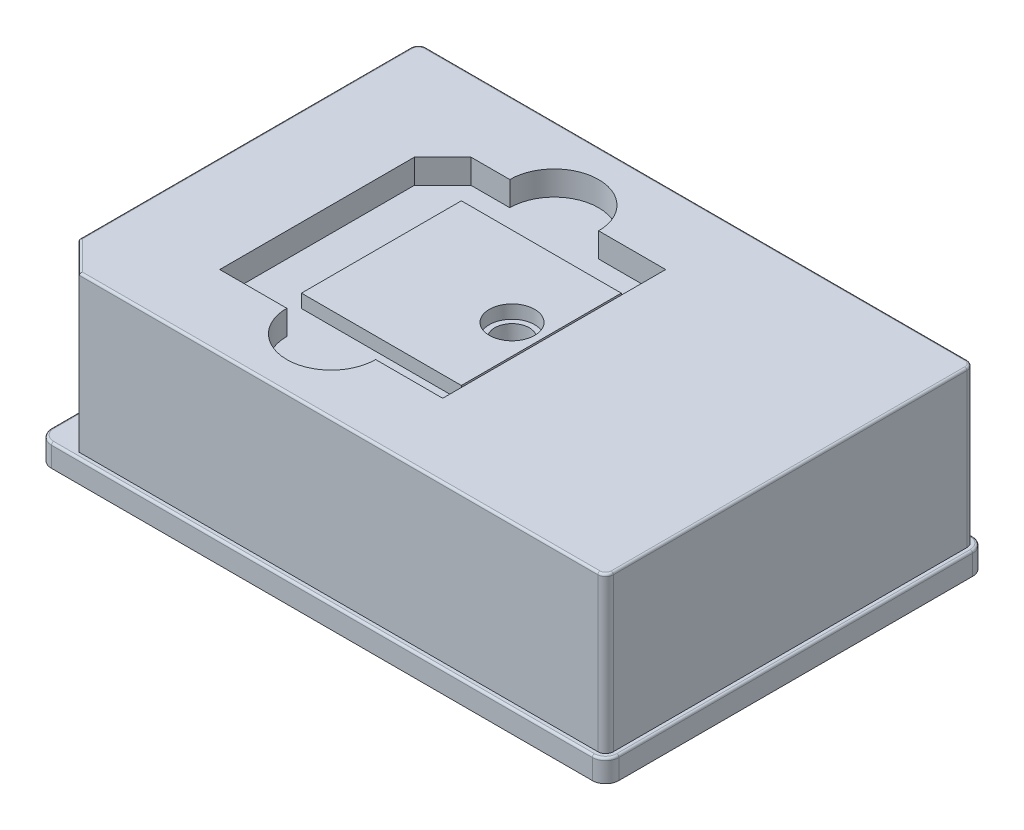
from build123d import *

# Parameters (mm, degrees)
SKETCH1_W           = 127.75
SKETCH1_H           = 85.6
BOSS_EXTRUDE1_DEPTH = 40
FILLET1_R           = 3
CUT_EXTRUDE2_DEPTH  = 35
FILLET5_R           = 0.5
FILLET6_R           = 0.5
CUT_EXTRUDE3_DEPTH  = 5.5
SKETCH8_W           = 36
SKETCH8_H           = 36
BOSS_EXTRUDE2_DEPTH = 3
SKETCH9_R           = 5.1
CUT_EXTRUDE5_DEPTH  = 3
SKETCH10_R          = 3.9
SKETCH11_R          = 3.7
SHELL1_DEPTH        = 35.5
SHELL1_START        = 35.5
SHELL1_2_DEPTH      = 2.5
SHELL1_3_DEPTH      = 3
SHELL1_START_2      = 3
SHELL1_4_DEPTH      = 0.5
SHELL1_START_3      = -55.046572875
SHELL1_6_DEPTH      = 115.671572875
BOSS_EXTRUDE3_REACH = 81.974
SKETCH13_W          = 2
SKETCH13_H          = 79.1
SKETCH13_H_2        = 33.940393737


with BuildPart() as part:
    # Sketch1 → Boss-Extrude1 (new body)
    with BuildSketch(Plane(origin=(0, 0, 0), x_dir=(1, 0, 0), z_dir=(0, 1, 0))):
        Rectangle(SKETCH1_W, SKETCH1_H)
    extrude(amount=BOSS_EXTRUDE1_DEPTH)

    # Fillet1
    fillet1_edges = [part.edges().sort_by_distance(p)[0] for p in [
        (-63.875, 20, -42.8),
        (63.875, 20, -42.8),
        (63.875, 20, 42.8),
        (-63.875, 20, 42.8),
    ]]
    fillet(fillet1_edges, radius=FILLET1_R)

    # Sketch3 → Cut-Extrude2 (cut)
    with BuildSketch(Plane(origin=(0, 40, 0), x_dir=(1, 0, 0), z_dir=(0, 1, 0))):
        with BuildLine():
            Line((-63.875, 39.8), (-63.875, -39.8))
            ThreePointArc((-63.875, -39.8), (-62.996320344, -41.921320344), (-60.875, -42.8))
            Line((-60.875, -42.8), (60.875, -42.8))
            ThreePointArc((60.875, -42.8), (62.996320344, -41.921320344), (63.875, -39.8))
            Line((63.875, -39.8), (63.875, 39.8))
            ThreePointArc((63.875, 39.8), (62.996320344, 41.921320344), (60.875, 42.8))
            Line((60.875, 42.8), (-60.875, 42.8))
            ThreePointArc((-60.875, 42.8), (-62.996320344, 41.921320344), (-63.875, 39.8))
        make_face()
        with BuildLine():
            Line((-62.625, 39.8), (-62.625, -34.8))
            Line((-62.625, -34.8), (-55.875, -41.55))
            Line((-55.875, -41.55), (60.875, -41.55))
            ThreePointArc((60.875, -41.55), (62.112436867, -41.037436867), (62.625, -39.8))
            Line((62.625, -39.8), (62.625, 39.8))
            ThreePointArc((62.625, 39.8), (62.112436867, 41.037436867), (60.875, 41.55))
            Line((60.875, 41.55), (-60.875, 41.55))
            ThreePointArc((-60.875, 41.55), (-62.112436867, 41.037436867), (-62.625, 39.8))
        make_face(mode=Mode.SUBTRACT)
    extrude(amount=-CUT_EXTRUDE2_DEPTH, mode=Mode.SUBTRACT)

    # Fillet5
    fillet5_edges = [part.edges().sort_by_distance(p)[0] for p in [
        (-62.996320344, 5, -41.921320344),
        (0, 5, -42.8),
        (62.996320344, 5, -41.921320344),
        (63.875, 5, 0),
        (62.996320344, 5, 41.921320344),
        (0, 5, 42.8),
        (-62.996320344, 5, 41.921320344),
        (-63.875, 5, 0),
    ]]
    fillet(fillet5_edges, radius=FILLET5_R)

    # Fillet6
    fillet6_edges = [part.edges().sort_by_distance(p)[0] for p in [
        (-62.112436867, 40, -41.037436867),
        (0, 40, -41.55),
        (62.112436867, 40, -41.037436867),
        (62.625, 40, 0),
        (62.112436867, 40, 41.037436867),
        (2.5, 40, 41.55),
        (-59.25, 40, 38.175),
        (-62.625, 40, -2.5),
    ]]
    fillet(fillet6_edges, radius=FILLET6_R)

    # Sketch5 → Cut-Extrude3 (cut)
    with BuildSketch(Plane(origin=(0, 40, 0), x_dir=(1, 0, 0), z_dir=(0, 1, 0))):
        with BuildLine():
            Line((-40.7, -25.1), (-25.6, -25.1))
            ThreePointArc((-25.6, -25.1), (-15.6, -35.1), (-5.6, -25.1))
            Line((-5.6, -25.1), (9.5, -25.1))
            Line((9.5, -25.1), (9.5, 25.1))
            Line((9.5, 25.1), (-5.6, 25.1))
            ThreePointArc((-5.6, 25.1), (-15.6, 35.1), (-25.6, 25.1))
            Line((-25.6, 25.1), (-34.336038969, 25.1))
            Line((-34.336038969, 25.1), (-40.7, 18.736038969))
            Line((-40.7, 18.736038969), (-40.7, -25.1))
        make_face()
    extrude(amount=-CUT_EXTRUDE3_DEPTH, mode=Mode.SUBTRACT)

    # Sketch8 → Boss-Extrude2 (add)
    with BuildSketch(Plane(origin=(0, 34.5, 0), x_dir=(1, 0, 0), z_dir=(0, 1, 0))):
        with Locations((-11.4, 0)):
            Rectangle(SKETCH8_W, SKETCH8_H)
    extrude(amount=BOSS_EXTRUDE2_DEPTH)

    # Sketch9 → Cut-Extrude5 (cut)
    with BuildSketch(Plane(origin=(0, 37.5, 0), x_dir=(1, 0, 0), z_dir=(0, 1, 0))):
        with Locations(Location((0, 0, 0), (0, 0, 270))):
            Circle(SKETCH9_R)
    extrude(amount=-CUT_EXTRUDE5_DEPTH, mode=Mode.SUBTRACT)

    # Sketch10 → Cut-Loft1 section 0
    with BuildSketch(Plane(origin=(0, 34.5, 0), x_dir=(1, 0, 0), z_dir=(0, 1, 0))):
        Circle(SKETCH10_R)
    # Sketch11 → Cut-Loft1 section 1
    with BuildSketch(Plane(origin=(0, 18.5, 0), x_dir=(1, 0, 0), z_dir=(0, 1, 0))):
        Circle(SKETCH11_R)
    loft(mode=Mode.SUBTRACT)

    # Sketch12 → Cut-Revolve1 (revolve, cut)
    with BuildSketch(Plane.XY, mode=Mode.PRIVATE) as cut_revolve1_sk:
        Polygon((0, 18.5), (3.700000041, 18.5), (1.65, 5.5), (0, 5.5), align=None)
    revolve(cut_revolve1_sk.sketch.rotate(Axis((0, 0, 0), (0, 1, 0)), 270), axis=Axis((0, 0, 0), (0, 1, 0)), mode=Mode.SUBTRACT)

    # Shell1: read off the stored shape, not the designer's step
    # Shell1 outline → Shell1 (cut)
    # profile 1 of 2: a face of its own
    with BuildSketch(Plane(origin=(0, 0, 0), x_dir=(1, 0, 0), z_dir=(0, 1, 0))):
        Polygon((60.625, -39.55), (60.625, 39.55), (-60.625, 39.55), (-60.625, -33.971572875), (-55.046572875, -39.55), align=None)
        with BuildLine():
            Line((-3.767840434, 27.1), (11.5, 27.1))
            Line((11.5, 27.1), (11.5, -27.1))
            Line((11.5, -27.1), (-3.767840434, -27.1))
            ThreePointArc((-3.767840434, -27.1), (-15.6, -37.1), (-27.432159566, -27.1))
            Line((-27.432159566, -27.1), (-42.7, -27.1))
            Line((-42.7, -27.1), (-42.7, 19.564466094))
            Line((-42.7, 19.564466094), (-35.164466094, 27.1))
            Line((-35.164466094, 27.1), (-27.432159566, 27.1))
            ThreePointArc((-27.432159566, 27.1), (-15.6, 37.1), (-3.767840434, 27.1))
        make_face(mode=Mode.SUBTRACT)
    # profile 2 of 2: a face of its own
    with BuildSketch(Plane(origin=(0, 0, 0), x_dir=(1, 0, 0), z_dir=(0, 1, 0))):
        with BuildLine():
            Line((4.6, -16), (4.6, -5.408326913))
            ThreePointArc((4.6, -5.408326913), (-7.1, 0), (4.6, 5.408326913))
            Line((4.6, 5.408326913), (4.6, 16))
            Line((4.6, 16), (-27.4, 16))
            Line((-27.4, 16), (-27.4, -16))
            Line((-27.4, -16), (4.6, -16))
        make_face()
    extrude(amount=SHELL1_DEPTH, mode=Mode.SUBTRACT)

    # Shell1 2 outline → Shell1 2 (cut)
    with BuildSketch(Plane(origin=(0, 0, 0), x_dir=(1, 0, 0), z_dir=(0, 1, 0)).offset(SHELL1_START)):
        Polygon((60.625, -39.55), (60.625, 39.55), (-60.625, 39.55), (-60.625, -33.971572875), (-55.046572875, -39.55), align=None)
        with BuildLine():
            Line((-3.767840434, 27.1), (11.5, 27.1))
            Line((11.5, 27.1), (11.5, -27.1))
            Line((11.5, -27.1), (-3.767840434, -27.1))
            ThreePointArc((-3.767840434, -27.1), (-15.6, -37.1), (-27.432159566, -27.1))
            Line((-27.432159566, -27.1), (-42.7, -27.1))
            Line((-42.7, -27.1), (-42.7, 19.564466094))
            Line((-42.7, 19.564466094), (-35.164466094, 27.1))
            Line((-35.164466094, 27.1), (-27.432159566, 27.1))
            ThreePointArc((-27.432159566, 27.1), (-15.6, 37.1), (-3.767840434, 27.1))
        make_face(mode=Mode.SUBTRACT)
    extrude(amount=SHELL1_2_DEPTH, mode=Mode.SUBTRACT)

    # Shell1 3 outline → Shell1 3 (cut)
    # profile 1 of 2: a face of its own
    with BuildSketch(Plane(origin=(0, 0, 0), x_dir=(1, 0, 0), z_dir=(0, 1, 0))):
        with BuildLine():
            Line((-61.875, 39.8), (-61.875, -39.8))
            ThreePointArc((-61.875, -39.8), (-61.582106781, -40.507106781), (-60.875, -40.8))
            Line((-60.875, -40.8), (60.875, -40.8))
            ThreePointArc((60.875, -40.8), (61.582106781, -40.507106781), (61.875, -39.8))
            Line((61.875, -39.8), (61.875, 39.8))
            ThreePointArc((61.875, 39.8), (61.582106781, 40.507106781), (60.875, 40.8))
            Line((60.875, 40.8), (-60.875, 40.8))
            ThreePointArc((-60.875, 40.8), (-61.582106781, 40.507106781), (-61.875, 39.8))
        make_face()
        Polygon((-60.625, 39.55), (60.625, 39.55), (60.625, -39.55), (-55.046572875, -39.55), (-60.625, -33.971572875), align=None, mode=Mode.SUBTRACT)
    # profile 2 of 2: a face of its own
    with BuildSketch(Plane(origin=(0, 0, 0), x_dir=(1, 0, 0), z_dir=(0, 1, 0))):
        with BuildLine():
            Line((11.5, -27.1), (11.5, 27.1))
            Line((11.5, 27.1), (-3.767840434, 27.1))
            ThreePointArc((-3.767840434, 27.1), (-15.6, 37.1), (-27.432159566, 27.1))
            Line((-27.432159566, 27.1), (-35.164466094, 27.1))
            Line((-35.164466094, 27.1), (-42.7, 19.564466094))
            Line((-42.7, 19.564466094), (-42.7, -27.1))
            Line((-42.7, -27.1), (-27.432159566, -27.1))
            ThreePointArc((-27.432159566, -27.1), (-15.6, -37.1), (-3.767840434, -27.1))
            Line((-3.767840434, -27.1), (11.5, -27.1))
        make_face()
        with BuildLine():
            ThreePointArc((4.6, 5.408326913), (-7.1, 0), (4.6, -5.408326913))
            Line((4.6, -5.408326913), (4.6, -16))
            Line((4.6, -16), (-27.4, -16))
            Line((-27.4, -16), (-27.4, 16))
            Line((-27.4, 16), (4.6, 16))
            Line((4.6, 16), (4.6, 5.408326913))
        make_face(mode=Mode.SUBTRACT)
    extrude(amount=SHELL1_3_DEPTH, mode=Mode.SUBTRACT)

    # Shell1 4 outline → Shell1 4 (cut)
    with BuildSketch(Plane(origin=(0, 0, 0), x_dir=(1, 0, 0), z_dir=(0, 1, 0)).offset(SHELL1_START_2)):
        with BuildLine():
            Line((11.5, -27.1), (11.5, 27.1))
            Line((11.5, 27.1), (-3.767840434, 27.1))
            ThreePointArc((-3.767840434, 27.1), (-15.6, 37.1), (-27.432159566, 27.1))
            Line((-27.432159566, 27.1), (-35.164466094, 27.1))
            Line((-35.164466094, 27.1), (-42.7, 19.564466094))
            Line((-42.7, 19.564466094), (-42.7, -27.1))
            Line((-42.7, -27.1), (-27.432159566, -27.1))
            ThreePointArc((-27.432159566, -27.1), (-15.6, -37.1), (-3.767840434, -27.1))
            Line((-3.767840434, -27.1), (11.5, -27.1))
        make_face()
        with BuildLine():
            ThreePointArc((4.6, 5.408326913), (-7.1, 0), (4.6, -5.408326913))
            Line((4.6, -5.408326913), (4.6, -16))
            Line((4.6, -16), (-27.4, -16))
            Line((-27.4, -16), (-27.4, 16))
            Line((-27.4, 16), (4.6, 16))
            Line((4.6, 16), (4.6, 5.408326913))
        make_face(mode=Mode.SUBTRACT)
    extrude(amount=SHELL1_4_DEPTH, mode=Mode.SUBTRACT)

    # Shell1 5 outline → Shell1 5 (revolve, cut)
    with BuildSketch(Plane.XY):
        Polygon((50.573708585, 32.5), (5.875156244, 32.5), (5.698041982, 18.330859059), (3.359329546, 3.5), (50.573708585, 3.5), align=None)
    revolve(axis=Axis((0, 0, 0), (0, 1, 0)), mode=Mode.SUBTRACT)

    # Shell1 6 outline → Shell1 6 (add)
    with BuildSketch(Plane.YZ.offset(SHELL1_START_3)):
        with BuildLine():
            Line((32.5, -39.55), (3.5, -39.55))
            Line((3.5, -39.55), (3.5, -42.8))
            Line((3.5, -42.8), (4.5, -42.8))
            ThreePointArc((4.5, -42.8), (4.853553391, -42.653553391), (5, -42.3))
            Line((5, -42.3), (5, -41.55))
            Line((5, -41.55), (32.5, -41.55))
            Line((32.5, -41.55), (32.5, -39.55))
        make_face()
        with BuildLine():
            Line((4.5, 42.8), (3.5, 42.8))
            Line((3.5, 42.8), (3.5, 39.55))
            Line((3.5, 39.55), (32.5, 39.55))
            Line((32.5, 39.55), (32.5, 41.55))
            Line((32.5, 41.55), (5, 41.55))
            Line((5, 41.55), (5, 42.3))
            ThreePointArc((5, 42.3), (4.853553391, 42.653553391), (4.5, 42.8))
        make_face()
    extrude(amount=SHELL1_6_DEPTH)

    # Sketch13 → Boss-Extrude3 (add, up to next)
    with BuildSketch(Plane(origin=(0, 22, 0), x_dir=(1, 0, 0), z_dir=(0, 1, 0)), mode=Mode.PRIVATE) as boss_extrude3_sk1:
        with Locations((-30.3125, 0)):
            Rectangle(SKETCH13_W, SKETCH13_H)
    boss_extrude3_tool1 = extrude(boss_extrude3_sk1.sketch, amount=BOSS_EXTRUDE3_REACH, mode=Mode.PRIVATE) - part.part
    # Sketch13 → Boss-Extrude3 (add, up to next)
    with BuildSketch(Plane(origin=(0, 22, 0), x_dir=(1, 0, 0), z_dir=(0, 1, 0)), mode=Mode.PRIVATE) as boss_extrude3_sk2:
        with Locations((30.3125, 0)):
            Rectangle(SKETCH13_W, SKETCH13_H)
    boss_extrude3_tool2 = extrude(boss_extrude3_sk2.sketch, amount=BOSS_EXTRUDE3_REACH, mode=Mode.PRIVATE) - part.part
    # Sketch13 → Boss-Extrude3 (add, up to next)
    with BuildSketch(Plane(origin=(0, 22, 0), x_dir=(1, 0, 0), z_dir=(0, 1, 0)), mode=Mode.PRIVATE) as boss_extrude3_sk3:
        with Locations((0, -22.579803132)):
            Rectangle(SKETCH13_W, SKETCH13_H_2)
    boss_extrude3_tool3 = extrude(boss_extrude3_sk3.sketch, amount=BOSS_EXTRUDE3_REACH, mode=Mode.PRIVATE) - part.part
    # Sketch13 → Boss-Extrude3 (add, up to next)
    with BuildSketch(Plane(origin=(0, 22, 0), x_dir=(1, 0, 0), z_dir=(0, 1, 0)), mode=Mode.PRIVATE) as boss_extrude3_sk4:
        with Locations((0, 22.579803132)):
            Rectangle(SKETCH13_W, SKETCH13_H_2)
    boss_extrude3_tool4 = extrude(boss_extrude3_sk4.sketch, amount=BOSS_EXTRUDE3_REACH, mode=Mode.PRIVATE) - part.part
    add(boss_extrude3_tool1.solids().sort_by_distance((-30.3125, 22, 0))[0])
    add(boss_extrude3_tool2.solids().sort_by_distance((30.3125, 22, 0))[0])
    add(boss_extrude3_tool3.solids().sort_by_distance((0, 22, 22.579803))[0])
    add(boss_extrude3_tool4.solids().sort_by_distance((0, 22, -22.579803))[0])


solid = part.part
